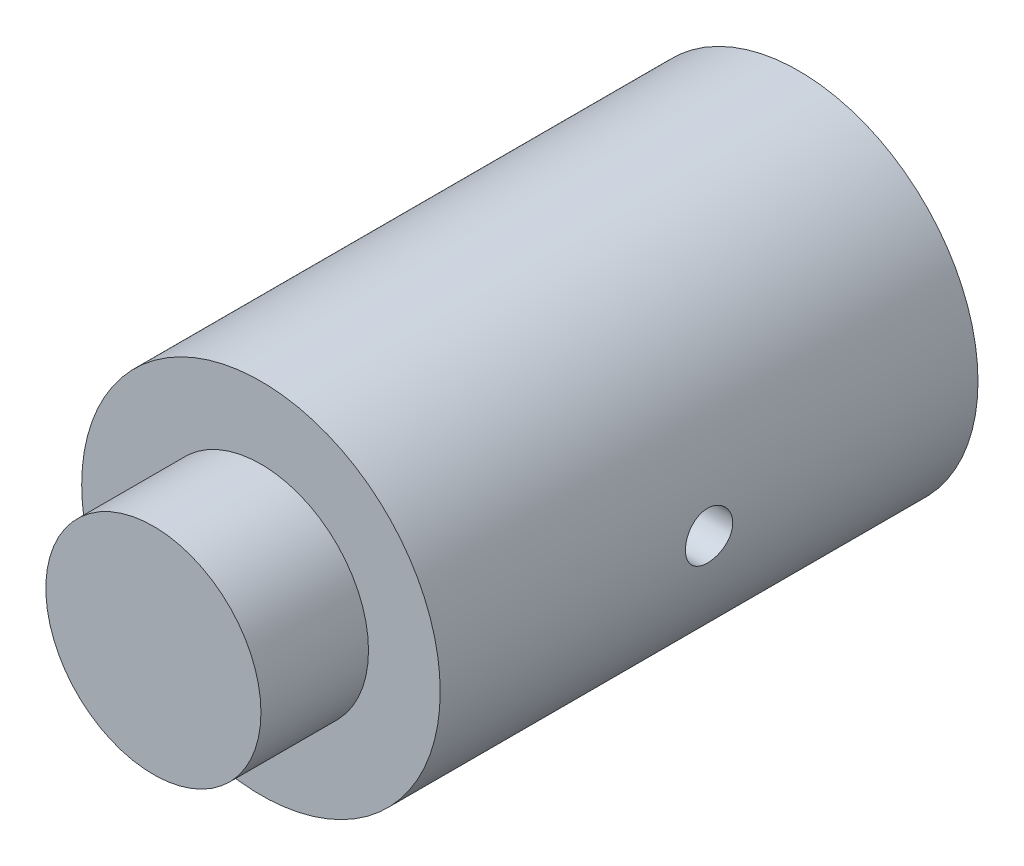
from build123d import *

# Parameters (mm, degrees)
SKETCH1_R               = 25
BOSS_EXTRUDE1_DEPTH     = 75
SKETCH2_R               = 15
BOSS_EXTRUDE2_DEPTH     = 15
CUT_EXTRUDE1_DEPTH      = 50
CUT_EXTRUDE1_DEPTH_BACK = 50
SKETCH3_R               = 3.3


with BuildPart() as part:
    # Sketch1 → Boss-Extrude1 (new body)
    with BuildSketch(Plane.XY):
        Circle(SKETCH1_R)
    extrude(amount=BOSS_EXTRUDE1_DEPTH)

    # Sketch2 → Boss-Extrude2 (add)
    with BuildSketch(Plane.XY.offset(75)):
        Circle(SKETCH2_R)
    extrude(amount=BOSS_EXTRUDE2_DEPTH)

    # Sketch3 → Cut-Extrude1 (cut, two sides: drawn at the far end of the back side and taken through both)
    with BuildSketch(Plane(origin=(0, 0, 0), x_dir=(0, 0, -1), z_dir=(1, 0, 0)).offset(-CUT_EXTRUDE1_DEPTH_BACK)):
        with Locations((-37.5, 0)):
            Circle(SKETCH3_R)
    extrude(amount=CUT_EXTRUDE1_DEPTH + CUT_EXTRUDE1_DEPTH_BACK, mode=Mode.SUBTRACT)


solid = part.part
